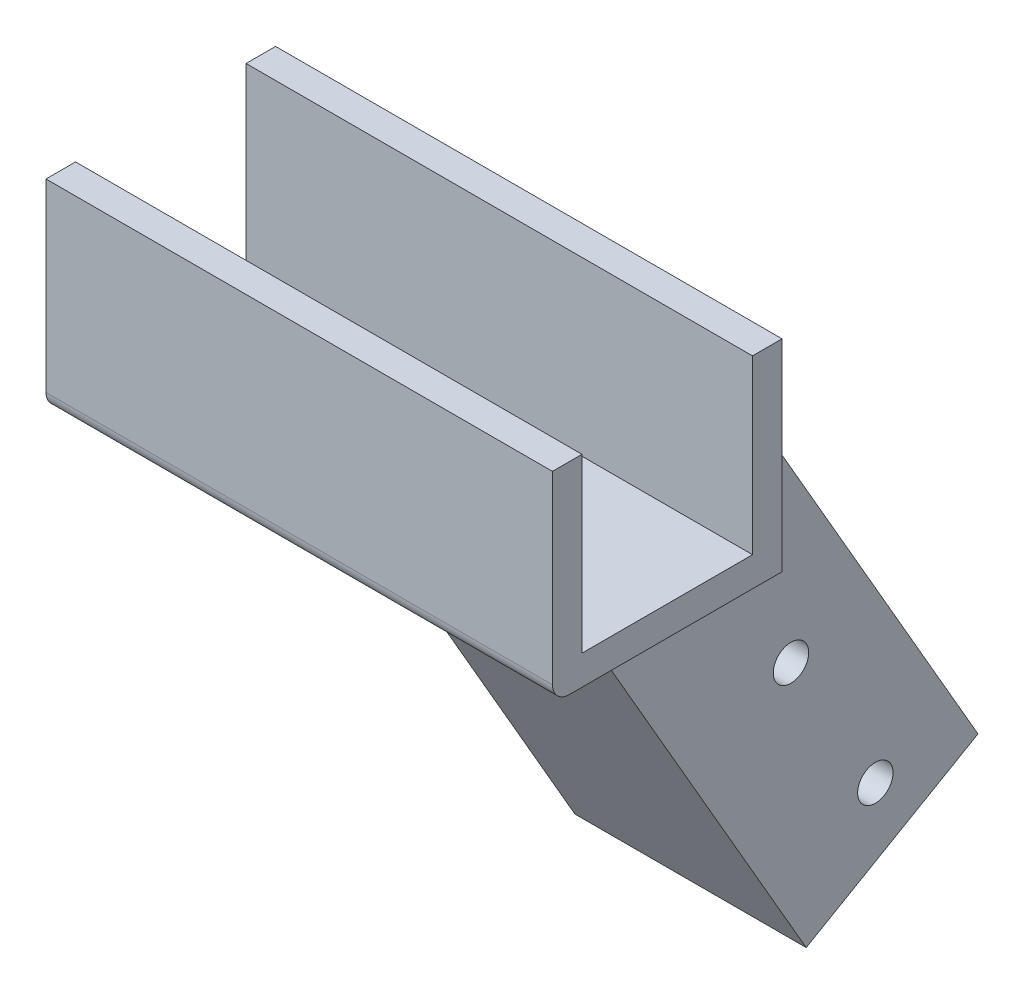
from build123d import *

# Parameters (mm, degrees)
SKETCH1_W           = 27.2
SKETCH1_H           = 23.9
BOSS_EXTRUDE1_DEPTH = 30
SHELL1_T            = -3.5
BOSS_EXTRUDE2_DEPTH = 13.7
SHELL3_START        = -10.2
SHELL3_DEPTH        = 20.4
FILLET2_R           = 2
SKETCH3_R           = 2.1
CUT_EXTRUDE1_DEPTH  = 97.890637096
FILLET3_R           = 10


# Read off the part's stored shape, not the designer's step: Shell3
with BuildPart() as part:
    # Sketch1 → Boss-Extrude1 (new, symmetric)
    with BuildSketch(Plane(origin=(0, 0, 0), x_dir=(0, 0, -1), z_dir=(1, 0, 0))):
        Rectangle(SKETCH1_W, SKETCH1_H)
    extrude(amount=BOSS_EXTRUDE1_DEPTH, both=True)

    # Shell1
    shell1_openings = [part.faces().sort_by_distance(p)[0] for p in [
        (30, 0, 0),
        (-30, 0, 0),
        (0, 11.95, 0),
    ]]
    offset(amount=SHELL1_T, openings=shell1_openings, kind=Kind.INTERSECTION)

    # Sketch2 → Boss-Extrude2 (add, symmetric)
    with BuildSketch(Plane(origin=(0, 0, 0), x_dir=(0, 0, -1), z_dir=(1, 0, 0))):
        Polygon((0.263208782, -11.95), (32.763208782, -68.241651246), (53.114805771, -56.491651246), (13.6, 11.95), (13.6, -11.95), align=None)
    extrude(amount=BOSS_EXTRUDE2_DEPTH, both=True)

    # Shell3 outline → Shell3 (cut)
    with BuildSketch(Plane.YZ.offset(SHELL3_START)):
        Polygon((8.45, -15.620725942), (8.45, -13.6), (-11.95, -13.6), (-11.95, -4.304660666), (-66.491651246, -35.794297695), (-56.491651246, -53.114805771), align=None)
    extrude(amount=SHELL3_DEPTH, mode=Mode.SUBTRACT)

    # Fillet2
    fillet2_edges = [part.edges().sort_by_distance(p)[0] for p in [
        (0, -11.95, 13.6),
    ]]
    fillet(fillet2_edges, radius=FILLET2_R)

    # Sketch3 → Cut-Extrude1 (cut, through all)
    with BuildSketch(Plane(origin=(13.7, 0, 0), x_dir=(0, 0, -1), z_dir=(1, 0, 0))):
        with Locations((40.954551733, -55.429473419)):
            Circle(SKETCH3_R)
        with Locations((30.954551733, -38.108965344)):
            Circle(SKETCH3_R)
        with Locations((20.954551733, -20.788457268)):
            Circle(SKETCH3_R)
    extrude(amount=-CUT_EXTRUDE1_DEPTH, mode=Mode.SUBTRACT)

    # Fillet3
    fillet3_edges = [part.edges().sort_by_distance(p)[0] for p in [
        (0, -11.95, -0.263208782),
    ]]
    fillet(fillet3_edges, radius=FILLET3_R)


solid = part.part
